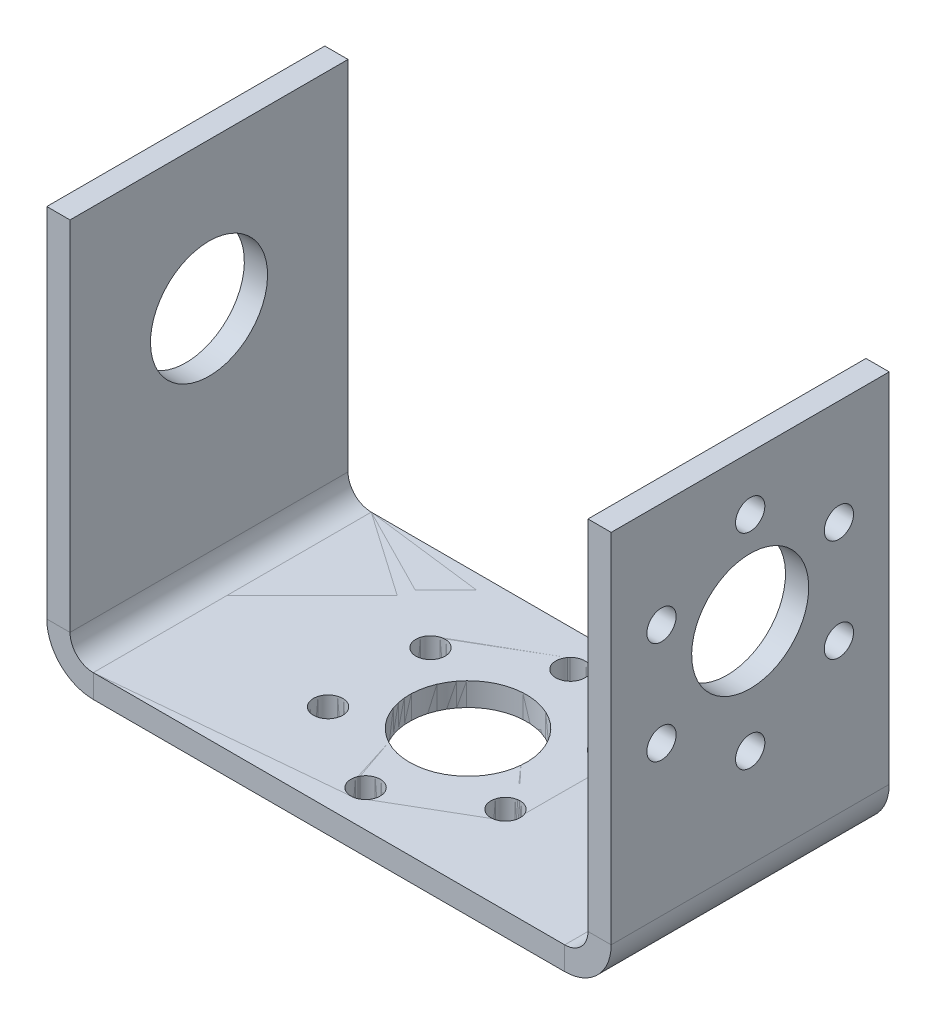
from build123d import *

# Parameters (mm, degrees)
ESQUISSE1_W                       = 32.22
ESQUISSE1_H                       = 19
ESQUISSE1_R                       = 4
ESQUISSE1_R_2                     = 1
BOSS_EXTRU_2_DEPTH                = 1.5875
CONVERTIR_VOLUME3_OUTLINE_W       = 32.22
CONVERTIR_VOLUME3_OUTLINE_H       = 19
CONVERTIR_VOLUME3_OUTLINE_R       = 1
CONVERTIR_VOLUME3_OUTLINE_R_2     = 4
CONVERTIR_VOLUME3_DEPTH           = 1.5875
T_LE_PLI_E_SUR_AR_TE1_DEPTH       = 19
T_LE_START                        = 1.5875
T_LE_PLI_E_SUR_AR_TE1_PROFILE_W   = 19
T_LE_PLI_E_SUR_AR_TE1_PROFILE_H   = 24.4125
T_LE_PLI_E_SUR_AR_TE1_PROFILE_R   = 4
T_LE_PLI_E_SUR_AR_TE1_FLAT_DEPTH  = 1.5875
T_LE_PLI_E_SUR_AR_TE2_DEPTH       = 19
T_LE_PLI_E_SUR_AR_TE2_PROFILE_W   = 19
T_LE_PLI_E_SUR_AR_TE2_PROFILE_H   = 24.4125
T_LE_PLI_E_SUR_AR_TE2_PROFILE_R   = 1
T_LE_PLI_E_SUR_AR_TE2_PROFILE_R_2 = 4
T_LE_PLI_E_SUR_AR_TE2_FLAT_DEPTH  = 1.5875


# Read off the part's stored shape, not the designer's step: Convertir-Volume3
# Sheet-metal steps are written as plain solids
with BuildPart() as part:
    # Esquisse1 → Boss.-Extru.2 (new body)
    with BuildSketch(Plane(origin=(0, 0, 0), x_dir=(1, 0, 0), z_dir=(0, 1, 0))):
        with Locations((16.11, 9.5)):
            Rectangle(ESQUISSE1_W, ESQUISSE1_H)
        with Locations(Location((16.11, 9.5, 0), (0, 0, 270))):
            Circle(ESQUISSE1_R, mode=Mode.SUBTRACT)
        with Locations(Location((16.11, 16.5, 0), (0, 0, 270))):
            Circle(ESQUISSE1_R_2, mode=Mode.SUBTRACT)
        with Locations(Location((22.172177826, 13, 0), (0, 0, 270))):
            Circle(ESQUISSE1_R_2, mode=Mode.SUBTRACT)
        with Locations(Location((22.172177826, 6, 0), (0, 0, 270))):
            Circle(ESQUISSE1_R_2, mode=Mode.SUBTRACT)
        with Locations(Location((16.11, 2.5, 0), (0, 0, 270))):
            Circle(ESQUISSE1_R_2, mode=Mode.SUBTRACT)
        with Locations(Location((10.047822174, 6, 0), (0, 0, 270))):
            Circle(ESQUISSE1_R_2, mode=Mode.SUBTRACT)
        with Locations(Location((10.047822174, 13, 0), (0, 0, 270))):
            Circle(ESQUISSE1_R_2, mode=Mode.SUBTRACT)
    extrude(amount=BOSS_EXTRU_2_DEPTH)


with BuildPart() as body_2:
    # Convertir-Volume3 outline → Convertir-Volume3 (new body)
    with BuildSketch(Plane(origin=(0, 0, 0), x_dir=(1, 0, 0), z_dir=(0, 1, 0))):
        with Locations((16.11, 9.5)):
            Rectangle(CONVERTIR_VOLUME3_OUTLINE_W, CONVERTIR_VOLUME3_OUTLINE_H)
        with Locations((10.047822174, 6)):
            Circle(CONVERTIR_VOLUME3_OUTLINE_R, mode=Mode.SUBTRACT)
        with Locations((16.11, 2.5)):
            Circle(CONVERTIR_VOLUME3_OUTLINE_R, mode=Mode.SUBTRACT)
        with Locations((22.172177826, 6)):
            Circle(CONVERTIR_VOLUME3_OUTLINE_R, mode=Mode.SUBTRACT)
        with Locations((10.047822174, 13)):
            Circle(CONVERTIR_VOLUME3_OUTLINE_R, mode=Mode.SUBTRACT)
        with Locations((16.11, 9.5)):
            Circle(CONVERTIR_VOLUME3_OUTLINE_R_2, mode=Mode.SUBTRACT)
        with Locations((22.172177826, 13)):
            Circle(CONVERTIR_VOLUME3_OUTLINE_R, mode=Mode.SUBTRACT)
        with Locations((16.11, 16.5)):
            Circle(CONVERTIR_VOLUME3_OUTLINE_R, mode=Mode.SUBTRACT)
    extrude(amount=CONVERTIR_VOLUME3_DEPTH)

    # Tôle pliée sur arête1 bend section (across the edge) → Tôle pliée sur arête1 (add)
    with BuildSketch(Plane(origin=(-1.5875, 1.5875, -19), x_dir=(1, 0, 0), z_dir=(0, 0, 1))):
        with BuildLine():
            Line((-1.5875, 1.5875), (0, 1.5875))
            ThreePointArc((0, 1.5875), (0.464967985, 0.464967985), (1.5875, 0))
            Line((1.5875, 0), (1.5875, -1.5875))
            ThreePointArc((1.5875, -1.5875), (-0.65756403, -0.65756403), (-1.5875, 1.5875))
        make_face()
    extrude(amount=T_LE_PLI_E_SUR_AR_TE1_DEPTH)

    # Tôle pliée sur arête1 profile (on flange) → Tôle pliée sur arête1 flat (add)
    with BuildSketch(Plane(origin=(-1.5875, 1.5875, 0), x_dir=(0, 0, 1), z_dir=(-1, 0, 0)).offset(T_LE_START)):
        with Locations((-9.5, 13.79375)):
            Rectangle(T_LE_PLI_E_SUR_AR_TE1_PROFILE_W, T_LE_PLI_E_SUR_AR_TE1_PROFILE_H)
        with Locations((-9.5, 16)):
            Circle(T_LE_PLI_E_SUR_AR_TE1_PROFILE_R, mode=Mode.SUBTRACT)
    extrude(amount=-T_LE_PLI_E_SUR_AR_TE1_FLAT_DEPTH)

    # Tôle pliée sur arête2 bend section (across the edge) → Tôle pliée sur arête2 (add)
    with BuildSketch(Plane(origin=(33.8075, 1.5875, 0), x_dir=(-1, 0, 0), z_dir=(0, 0, -1))):
        with BuildLine():
            Line((-1.5875, 1.5875), (0, 1.5875))
            ThreePointArc((0, 1.5875), (0.464967985, 0.464967985), (1.5875, 0))
            Line((1.5875, 0), (1.5875, -1.5875))
            ThreePointArc((1.5875, -1.5875), (-0.65756403, -0.65756403), (-1.5875, 1.5875))
        make_face()
    extrude(amount=T_LE_PLI_E_SUR_AR_TE2_DEPTH)

    # Tôle pliée sur arête2 profile (on flange) → Tôle pliée sur arête2 flat (add)
    with BuildSketch(Plane(origin=(33.8075, 1.5875, 0), x_dir=(0, 0, -1), z_dir=(1, 0, 0)).offset(T_LE_START)):
        with Locations((9.5, 13.79375)):
            Rectangle(T_LE_PLI_E_SUR_AR_TE2_PROFILE_W, T_LE_PLI_E_SUR_AR_TE2_PROFILE_H)
        with Locations((9.5, 8.310060418)):
            Circle(T_LE_PLI_E_SUR_AR_TE2_PROFILE_R, mode=Mode.SUBTRACT)
        with Locations((15.562177826, 11.810060418)):
            Circle(T_LE_PLI_E_SUR_AR_TE2_PROFILE_R, mode=Mode.SUBTRACT)
        with Locations((3.437822174, 11.810060418)):
            Circle(T_LE_PLI_E_SUR_AR_TE2_PROFILE_R, mode=Mode.SUBTRACT)
        with Locations((15.562177826, 18.810060418)):
            Circle(T_LE_PLI_E_SUR_AR_TE2_PROFILE_R, mode=Mode.SUBTRACT)
        with Locations((9.5, 16)):
            Circle(T_LE_PLI_E_SUR_AR_TE2_PROFILE_R_2, mode=Mode.SUBTRACT)
        with Locations((3.437822174, 18.810060418)):
            Circle(T_LE_PLI_E_SUR_AR_TE2_PROFILE_R, mode=Mode.SUBTRACT)
        with Locations((9.5, 22.310060418)):
            Circle(T_LE_PLI_E_SUR_AR_TE2_PROFILE_R, mode=Mode.SUBTRACT)
    extrude(amount=-T_LE_PLI_E_SUR_AR_TE2_FLAT_DEPTH)


solid = Compound([part.part, body_2.part])
